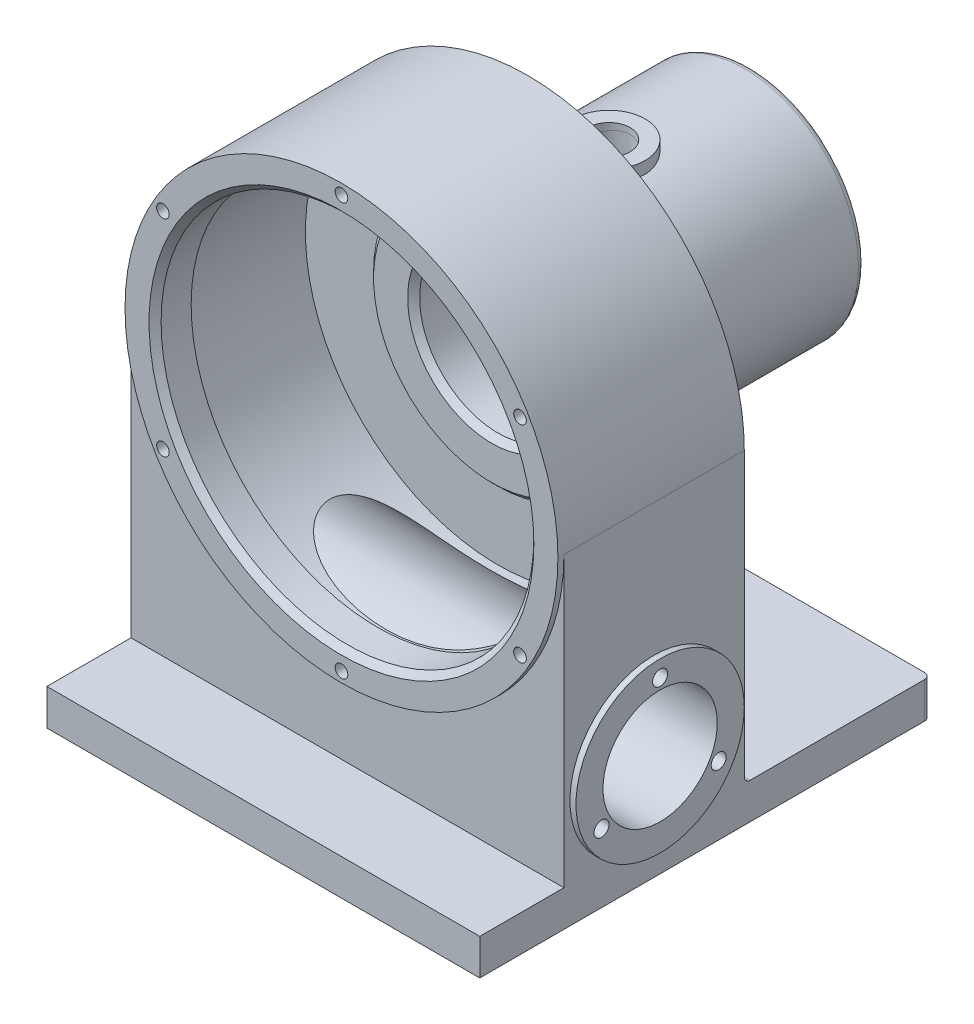
from build123d import *

# Parameters (mm, degrees)
SKETCH_2_W                       = 150
SKETCH_2_H                       = 12
EXTRUDE_1_DEPTH                  = 72
EXTRUDE_START                    = -60
EXTRUDE_2_DEPTH                  = 60
SKETCH_4_R                       = 28
EXTRUDE_3_DEPTH                  = 2
SKETCH_5_R                       = 12
EXTRUDE_4_DEPTH                  = 2
EXTRUDE_4_DIRECTION_2_REACH      = 187.839
EXTRUDE_4_DIRECTION_2_END_RADIUS = 38
PATTERN_CIRCULAR_1_COUNT         = 3
SKETCH_10_R                      = 19
CUT_EXTRUDE_1_DEPTH              = 225.445984593
PATTERN_CIRCULAR_2_COUNT         = 6
EXTRUDE_5_DEPTH                  = 5
SKETCH_18_R                      = 19
CUT_EXTRUDE_2_DEPTH              = 226.752076468
FILLET_1_R                       = 2


# Read off the part's stored shape, not the designer's step: 旋转1
with BuildPart() as part:
    # 旋转1 outline → 旋转1 (revolve)
    with BuildSketch(Plane.XZ.offset(38)):
        Polygon((28, -74), (38, -74), (38, 0), (72, 0), (72, 62), (64, 62), (62, 60), (62, 50), (64, 50), (64, 10), (41.318706697, 10), (39.318706697, 12), (28, 12), (26, 10), (26, -72), align=None)
    revolve(axis=Axis((0, -38, 0), (0, 0, 1)))



with BuildPart() as body_2:
    # 草图2 → 凸台-拉伸1 (new, symmetric)
    with BuildSketch(Plane(origin=(0, 0, 0), x_dir=(0, 0, -1), z_dir=(1, 0, 0))):
        with Locations((-13, -140)):
            Rectangle(SKETCH_2_W, SKETCH_2_H)
    extrude(amount=EXTRUDE_1_DEPTH, both=True)


with BuildPart() as part_1:
    add(part.part)

    add(body_2.part)  # 凸台-拉伸2 merges body 2
    # 草图3 → 凸台-拉伸2 (add)
    with BuildSketch(Plane(origin=(0, 0, 0), x_dir=(-1, 0, 0), z_dir=(0, 0, -1)).offset(EXTRUDE_START)):
        with BuildLine():
            Line((-72, -38), (-72, -134))
            Line((-72, -134), (72, -134))
            Line((72, -134), (72, -38))
            ThreePointArc((72, -38), (0, -110), (-72, -38))
        make_face()
    extrude(amount=EXTRUDE_2_DEPTH)

    # 草图4 → 凸台-拉伸3 (add)
    with BuildSketch(Plane(origin=(72, 0, 0), x_dir=(0, 0, -1), z_dir=(1, 0, 0))):
        with Locations((-30, -110)):
            Circle(SKETCH_4_R)
    extrude_3 = extrude(amount=EXTRUDE_3_DEPTH)

    # 草图7 → M6 螺纹孔1 (revolve, cut)
    with BuildSketch(Plane(origin=(74, -87.5, 30), x_dir=(0, 0, -1), z_dir=(0, 1, 0))):
        Polygon((0, 0), (0, 16.502151548), (2.5, 15), (2.5, 0), align=None)
    hole_wizard_m6_1 = revolve(axis=Axis((80.35, -87.5, 30), (-1, 0, 0)), mode=Mode.SUBTRACT)

    # 阵列(圆周)1: M6 螺纹孔1 ×3 about axis
    pattern_circular_1_axis = Axis((0, -110, 30), (1, 0, 0))
    for i in range(1, PATTERN_CIRCULAR_1_COUNT):
        add(hole_wizard_m6_1.rotate(pattern_circular_1_axis, i * 360 / PATTERN_CIRCULAR_1_COUNT), mode=Mode.SUBTRACT)

    # 草图10 → 切除-拉伸1 (cut, through all)
    with BuildSketch(Plane(origin=(74, 0, 0), x_dir=(0, 0, -1), z_dir=(1, 0, 0))):
        with Locations((-30, -110)):
            Circle(SKETCH_10_R)
    extrude(amount=-CUT_EXTRUDE_1_DEPTH, mode=Mode.SUBTRACT)

    # 草图15 → M5 螺纹孔1 (revolve, cut)
    with BuildSketch(Plane(origin=(0, 30.581845038, 62), x_dir=(0, -1, 0), z_dir=(1, 0, 0))):
        Polygon((0, 0), (0, 16.2618073), (2.1, 15), (2.1, 0), align=None)
    hole_wizard_m5_1 = revolve(axis=Axis((0, 30.581845038, 68.35), (0, 0, -1)), mode=Mode.SUBTRACT)

    # 阵列(圆周)2: M5 螺纹孔1 ×6 about axis
    pattern_circular_2_axis = Axis((0, -38, 0), (0, 0, 1))
    for i in range(1, PATTERN_CIRCULAR_2_COUNT):
        add(hole_wizard_m5_1.rotate(pattern_circular_2_axis, i * 360 / PATTERN_CIRCULAR_2_COUNT), mode=Mode.SUBTRACT)

    # 草图16 → 凸台-拉伸5 (add, symmetric)
    with BuildSketch(Plane(origin=(0, 0, 0), x_dir=(0, 0, -1), z_dir=(1, 0, 0))):
        with BuildLine():
            Line((0, -134), (0, -72))
            Line((0, -72), (56, -72))
            Line((56, -72), (56, -76))
            ThreePointArc((56, -76), (50.052201263, -77.394124903), (48.409082634, -83.27800587))
            Line((48.409082634, -83.27800587), (62, -134))
            Line((62, -134), (0, -134))
        make_face()
    extrude(amount=EXTRUDE_5_DEPTH, both=True)


with BuildPart() as body_2_2:
    # 草图5 → 凸台-拉伸4 (new body)
    with BuildSketch(Plane(origin=(0, 0, 0), x_dir=(1, 0, 0), z_dir=(0, 1, 0))):
        with Locations(Location((0, 27, 0), (0, 0, 270))):
            Circle(SKETCH_5_R)
    extrude(amount=EXTRUDE_4_DEPTH)

    # 凸台-拉伸4 direction 2: up to this cylinder (the profile starts outside it)
    extrude_4_direction_2_end = Plane(origin=(0, -38, -27), z_dir=(0, 0, 1)) * Cylinder(EXTRUDE_4_DIRECTION_2_END_RADIUS, 452.678, mode=Mode.PRIVATE)
    # 草图5 → 凸台-拉伸4 direction 2 (add, up to the surface)
    with BuildSketch(Plane(origin=(0, 0, 0), x_dir=(1, 0, 0), z_dir=(0, 1, 0)), mode=Mode.PRIVATE) as extrude_4_direction_2_sk1:
        with Locations(Location((0, 27, 0), (0, 0, 270))):
            Circle(SKETCH_5_R)
    extrude_4_direction_2_tool1 = extrude(extrude_4_direction_2_sk1.sketch, amount=-EXTRUDE_4_DIRECTION_2_REACH, mode=Mode.PRIVATE) - extrude_4_direction_2_end
    add(extrude_4_direction_2_tool1.solids().sort_by_distance((0, 0, -27))[0])
    add(extrude_4_direction_2_tool1.solids().sort_by_distance((0, 0, -27))[1])


with BuildPart() as hole_wizard_m16_1_tool:
    # 草图17 → M16 螺纹孔1 (revolve)
    with BuildSketch(Plane(origin=(0, 2, -27), x_dir=(0, 0, 1), z_dir=(1, 0, 0))):
        Polygon((0, 0), (0, 42.206024333), (7, 38), (7, 0), align=None)
    revolve(axis=Axis((0, 8.35, -27), (0, -1, 0)))


with BuildPart() as part_2:
    add(part_1.part)

    # M16 螺纹孔1: cut by hole_wizard_m16_1_tool
    add(hole_wizard_m16_1_tool.part, mode=Mode.SUBTRACT)

    # 镜向1: 凸台-拉伸3, M6 螺纹孔1 across plane
    add(extrude_3.mirror(Plane(origin=(0, 0, 0), x_dir=(0, 0, 1), z_dir=(1, 0, 0))))
    add(hole_wizard_m6_1.mirror(Plane(origin=(0, 0, 0), x_dir=(0, 0, 1), z_dir=(1, 0, 0))), mode=Mode.SUBTRACT)

    # 镜向1 copy 1 sketch → 镜向1 copy 1 (revolve, cut)
    with BuildSketch(Plane(origin=(-74, -121.25, 49.485571585), x_dir=(0, 0.8660254037844387, 0.4999999999999998), z_dir=(0, -0.4999999999999998, 0.8660254037844387))):
        Polygon((0, 0), (0, -16.502151548), (2.5, -15), (2.5, 0), align=None)
    revolve(axis=Axis((-80.35, -121.25, 49.485571585), (-1, 0, 0)), mode=Mode.SUBTRACT)

    # 镜向1 copy 2 sketch → 镜向1 copy 2 (revolve, cut)
    with BuildSketch(Plane(origin=(-74, -121.25, 10.514428415), x_dir=(0, -0.8660254037844384, 0.5000000000000004), z_dir=(0, -0.5000000000000004, -0.8660254037844384))):
        Polygon((0, 0), (0, -16.502151548), (2.5, -15), (2.5, 0), align=None)
    revolve(axis=Axis((-80.35, -121.25, 10.514428415), (-1, 0, 0)), mode=Mode.SUBTRACT)

    # 草图18 → 切除-拉伸2 (cut, through all)
    with BuildSketch(Plane.ZY.offset(74)):
        with Locations(Location((30, -110, 0), (0, 0, 180))):
            Circle(SKETCH_18_R)
    extrude(amount=-CUT_EXTRUDE_2_DEPTH, mode=Mode.SUBTRACT)

    # 圆角1
    # the kernel refuses this fillet: 2 mm, written as the material it adds along each edge
    with BuildSketch(Plane(origin=(7, -132, -2), x_dir=(-1, 0, 0), z_dir=(0, 0, 1))) as fillet_1_piece_1_section:
        Polygon((0, 0), (FILLET_1_R, 0), (FILLET_1_R, FILLET_1_R), (0, FILLET_1_R), align=None)
    fillet_1_piece_1 = extrude(amount=FILLET_1_R, mode=Mode.PRIVATE)
    fillet_1_piece_1 = fillet_1_piece_1 - Plane(origin=(7, -132, -2), x_dir=(0.7071067811865475, 0.7071067811865475, 0), z_dir=(0, 0, 1)) * Sphere(FILLET_1_R, mode=Mode.PRIVATE)
    add(fillet_1_piece_1)
    with BuildSketch(Plane(origin=(0, -134, 0), x_dir=(0, 0, -1), z_dir=(-1, 0, 0))) as fillet_1_piece_2:
        with BuildLine():
            CenterArc((FILLET_1_R, -FILLET_1_R), FILLET_1_R, 90, 90)
            Line((0, -FILLET_1_R), (0, 0))
            Line((0, 0), (FILLET_1_R, 0))
        make_face()
    extrude(amount=72)
    with BuildSketch(Plane(origin=(0, -38, 0), x_dir=(1, 0, 0), z_dir=(0, -1, 0))) as fillet_1_piece_3:
        with BuildLine():
            CenterArc((38 + FILLET_1_R, -FILLET_1_R), FILLET_1_R, 90, 90)
            Line((38 + FILLET_1_R, 0), (38, 0))
            Line((38, 0), (38, -FILLET_1_R))
        make_face()
    revolve(axis=Axis((0, -38, 0), (0, 0, 1)), revolution_arc=270.003880482)
    with BuildSketch(Plane(origin=(5, -132, 0), x_dir=(0, 0, -1), z_dir=(0, 1, 0))) as fillet_1_piece_4:
        with BuildLine():
            CenterArc((FILLET_1_R, -FILLET_1_R), FILLET_1_R, 90, 90)
            Line((0, -FILLET_1_R), (0, 0))
            Line((0, 0), (FILLET_1_R, 0))
        make_face()
    extrude(amount=61.330383596)
    with BuildSketch(Plane(origin=(5, -134, -62), x_dir=(0, 1, 0), z_dir=(0, 0, 1))) as fillet_1_piece_5_section:
        with BuildLine():
            CenterArc((FILLET_1_R, -FILLET_1_R), FILLET_1_R, 90, 90)
            Line((0, -FILLET_1_R), (0, 0))
            Line((0, 0), (FILLET_1_R, 0))
        make_face()
    fillet_1_piece_5 = extrude(amount=60, mode=Mode.PRIVATE)
    fillet_1_piece_5 = split(fillet_1_piece_5, bisect_by=Plane(origin=(5.453277918, -126.063122402, -59.873320057), z_dir=(0, -0.25881904510252507, 0.9659258262890672)), keep=Keep.TOP, mode=Mode.PRIVATE)
    add(fillet_1_piece_5)
    with BuildSketch(Plane(origin=(-5, -134, -62), x_dir=(0, 1, 0), z_dir=(0, 0, 1))) as fillet_1_piece_6_section:
        with BuildLine():
            CenterArc((FILLET_1_R, FILLET_1_R), FILLET_1_R, 180, 90)
            Line((0, FILLET_1_R), (0, 0))
            Line((0, 0), (FILLET_1_R, 0))
        make_face()
    fillet_1_piece_6 = extrude(amount=67, mode=Mode.PRIVATE)
    fillet_1_piece_6 = split(fillet_1_piece_6, bisect_by=Plane(origin=(-5.453262155, -125.813096524, -59.806325825), z_dir=(0, -0.25881904510252507, 0.9659258262890672)), keep=Keep.TOP, mode=Mode.PRIVATE)
    add(fillet_1_piece_6)
    with BuildSketch(Plane(origin=(72, -134, 0), x_dir=(0, 0, -1), z_dir=(-1, 0, 0))) as fillet_1_piece_7:
        with BuildLine():
            CenterArc((FILLET_1_R, -FILLET_1_R), FILLET_1_R, 90, 90)
            Line((0, -FILLET_1_R), (0, 0))
            Line((0, 0), (FILLET_1_R, 0))
        make_face()
    extrude(amount=65)
    with BuildSketch(Plane(origin=(0, -38, 0), x_dir=(0.00033831377328804734, -0.9999999427718936, 0), z_dir=(-0.9999999427718936, -0.00033831377328804734, 0))) as fillet_1_piece_8:
        with BuildLine():
            CenterArc((38 + FILLET_1_R, -FILLET_1_R), FILLET_1_R, 90, 90)
            Line((38 + FILLET_1_R, 0), (38, 0))
            Line((38, 0), (38, -FILLET_1_R))
        make_face()
    revolve(axis=Axis((0, -38, 0), (0, 0, 1)), revolution_arc=89.980616048)
    # the kernel refuses this fillet: 2 mm, written as the material it takes off along each edge
    with BuildSketch(Plane(origin=(0, -38, -74), x_dir=(1, 0, 0), z_dir=(0, -1, 0))) as fillet_1_2_piece_1:
        with BuildLine():
            CenterArc((38 - FILLET_1_R, FILLET_1_R), FILLET_1_R, 270, 90)
            Line((38 - FILLET_1_R, 0), (38, 0))
            Line((38, 0), (38, FILLET_1_R))
        make_face()
    revolve(axis=Axis((0, -38, -74), (0, 0, 1)), mode=Mode.SUBTRACT)
    with BuildSketch(Plane(origin=(-72, -129, -62), x_dir=(0, 0, 1), z_dir=(0, -1, 0)), Plane(origin=(72, -129, -62), x_dir=(-1, 0, 0), z_dir=(0, -1, 0))) as fillet_1_2_piece_2:
        with BuildLine():
            CenterArc((FILLET_1_R, -FILLET_1_R), FILLET_1_R, 90, 90)
            Line((0, -FILLET_1_R), (0, 0))
            Line((0, 0), (FILLET_1_R, 0))
        make_face()
    extrude(amount=22, mode=Mode.SUBTRACT)


with BuildPart() as body_2_2_1:
    add(body_2_2.part)

    # M16 螺纹孔1: cut by hole_wizard_m16_1_tool
    add(hole_wizard_m16_1_tool.part, mode=Mode.SUBTRACT)


solid = Compound([part_2.part, body_2_2_1.part])
